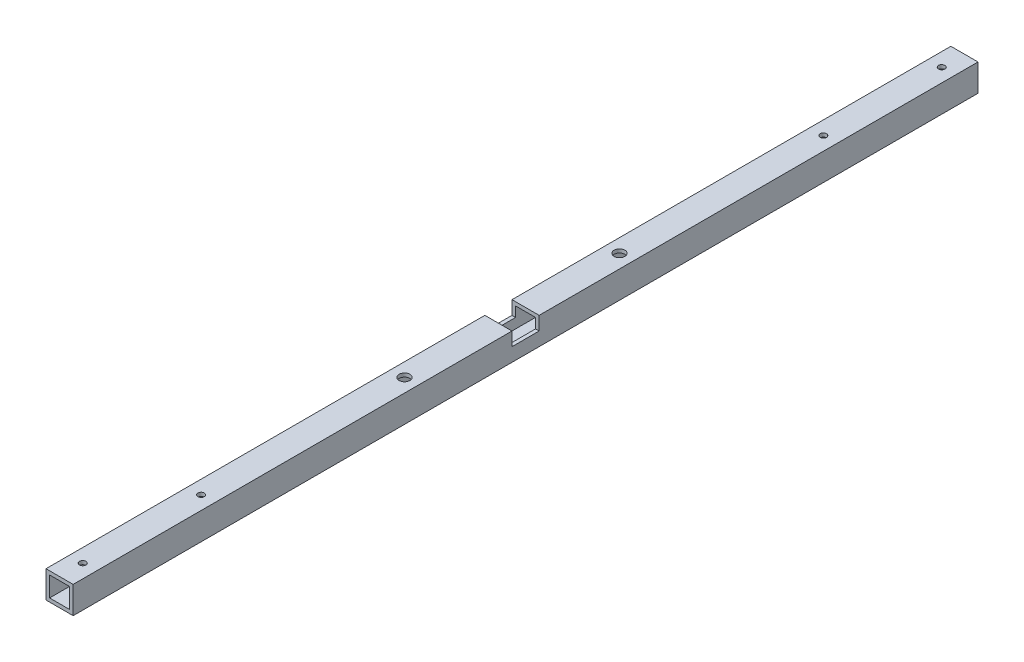
from build123d import *

# Parameters (mm, degrees)
BOSS_EXTRU_3_DEPTH      = 250
BOSS_EXTRU_3_DEPTH_BACK = 0.0001
ESQUISSE3_W             = 7.5
ESQUISSE3_H             = 7.5
ESQUISSE4_W             = 5.5
ESQUISSE4_H             = 5.5
ENL_V_MAT_EXTRU_3_DEPTH = 255.43419698
ESQUISSE6_W             = 7.5
ESQUISSE6_H             = 7.5
ENL_V_MAT_EXTRU_4_DEPTH = 3.75
TROU_TARAUD_2_561_D     = 1.778
TROU_TARAUD_2_562_D     = 1.778
PER_AGE1_START          = 14.402314812
PER_AGE1_OUTLINE_R      = 1.5
PER_AGE1_DEPTH          = 1
PER_AGE2_START          = 7.902314812
PER_AGE2_OUTLINE_R      = 1.5
PER_AGE2_DEPTH          = 1


# Read off the part's stored shape, not the designer's step: Perçage1, Perçage2
with BuildPart() as part:
    # Esquisse3 → Boss.-Extru.3 (new, two sides: drawn at the far end of the back side and taken through both)
    with BuildSketch(Plane.XY.offset(-BOSS_EXTRU_3_DEPTH_BACK)):
        with Locations((-40.965537472, 11.652314812)):
            Rectangle(ESQUISSE3_W, ESQUISSE3_H)
    extrude(amount=BOSS_EXTRU_3_DEPTH + BOSS_EXTRU_3_DEPTH_BACK)

    # Esquisse4 → Enlèv. mat.-Extru.3 (cut, through all)
    with BuildSketch(Plane.XY.offset(250)):
        with Locations((-40.965537472, 11.652314812)):
            Rectangle(ESQUISSE4_W, ESQUISSE4_H)
    extrude(amount=-ENL_V_MAT_EXTRU_3_DEPTH, mode=Mode.SUBTRACT)

    # Esquisse6 → Enlèv. mat.-Extru.4 (cut)
    with BuildSketch(Plane(origin=(0, 15.402314812, 0), x_dir=(-1, 0, 0), z_dir=(0, 1, 0))):
        with Locations((40.965537472, 124.9999)):
            Rectangle(ESQUISSE6_W, ESQUISSE6_H)
    extrude(amount=-ENL_V_MAT_EXTRU_4_DEPTH, mode=Mode.SUBTRACT)

    # Trou taraudé #2-561 (through all)
    with Locations(Plane.XZ.offset(-7.902314812)):
        with Locations((-40.965537472, 243.6), (-40.965537472, 210.9)):
            Hole(TROU_TARAUD_2_561_D / 2)

    # Trou taraudé #2-562 (through all)
    with Locations(Plane.XZ.offset(-7.902314812)):
        with Locations((-40.965537472, 38.972883346), (-40.965537472, 6.272883346)):
            Hole(TROU_TARAUD_2_562_D / 2)

    # Perçage1 outline → Perçage1 (cut)
    with BuildSketch(Plane(origin=(0, 0, 0), x_dir=(1, 0, 0), z_dir=(0, 1, 0)).offset(PER_AGE1_START)):
        with Locations((-40.965537472, -154.69838481)):
            Circle(PER_AGE1_OUTLINE_R)
        with Locations((-40.965537472, -95.30141519)):
            Circle(PER_AGE1_OUTLINE_R)
    extrude(amount=PER_AGE1_DEPTH, mode=Mode.SUBTRACT)

    # Perçage2 outline → Perçage2 (cut)
    with BuildSketch(Plane(origin=(0, 0, 0), x_dir=(1, 0, 0), z_dir=(0, 1, 0)).offset(PER_AGE2_START)):
        with Locations((-40.965537472, -154.69838481)):
            Circle(PER_AGE2_OUTLINE_R)
        with Locations((-40.965537472, -95.30141519)):
            Circle(PER_AGE2_OUTLINE_R)
    extrude(amount=PER_AGE2_DEPTH, mode=Mode.SUBTRACT)


solid = part.part
